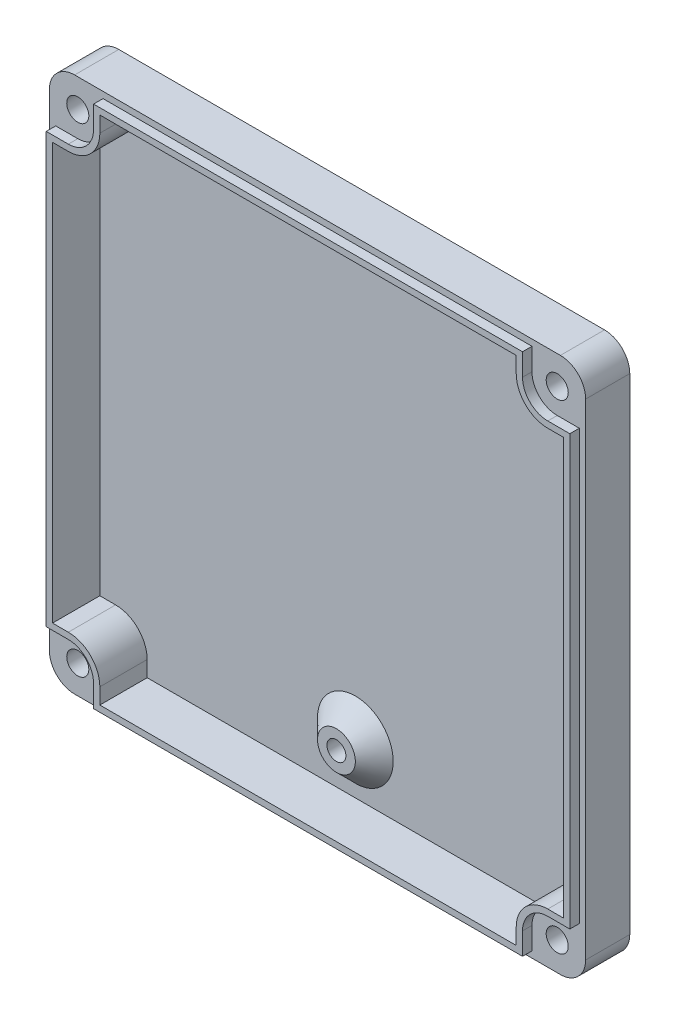
from build123d import *

# Parameters (mm, degrees)
SKETCH1_W                = 85
SKETCH1_H                = 85
BOSS_EXTRUDE1_DEPTH      = 7
FILLET1_R                = 4
SHELL1_T                 = -2
SHELL1_THICKNESS_2_DEPTH = 1
BOSS_EXTRUDE2_START      = 1
BOSS_EXTRUDE2_DEPTH      = 6
CIRPATTERN5_COUNT        = 4
SKETCH4_R                = 1.75
CUT_EXTRUDE1_DEPTH       = 61.510329697
MOVE_FACE1_BY            = 0.5
MOVE_FACE1_2_BY          = 0.5
MOVE_FACE1_3_BY          = 0.5
MOVE_FACE1_4_BY          = 0.5
MOVE_FACE1_5_BY          = 0.5
MOVE_FACE1_6_BY          = 0.5
MOVE_FACE1_7_BY          = 0.5
MOVE_FACE1_8_BY          = 0.5
MOVE_FACE1_9_BY          = 0.5
MOVE_FACE1_10_BY         = 0.5
MOVE_FACE1_11_BY         = 0.5
MOVE_FACE1_12_BY         = 0.5
EXTRUDE_THIN1_DEPTH      = 1.5
CIRPATTERN6_COUNT        = 4
SKETCH15_R               = 3.25
CUT_EXTRUDE5_DEPTH       = 2
EXTRUDE_THIN2_START      = -2
SKETCH16_R               = 2.25
SKETCH16_R_2             = 1.75
EXTRUDE_THIN2_DEPTH      = 2
SKETCH17_R               = 1.5
CUT_EXTRUDE6_DEPTH       = 61.702141643
SKETCH22_R               = 3
SKETCH22_R_2             = 1.5
BOSS_EXTRUDE5_DEPTH      = 3
CHAMFER2_SIZE            = 3


with BuildPart() as part:
    # Sketch1 → Boss-Extrude1 (new body)
    with BuildSketch(Plane.XY):
        Rectangle(SKETCH1_W, SKETCH1_H)
    extrude(amount=BOSS_EXTRUDE1_DEPTH)

    # Fillet1
    fillet1_edges = [part.edges().sort_by_distance(p)[0] for p in [
        (42.5, -42.5, 3.5),
        (-42.5, -42.5, 3.5),
        (-42.5, 42.5, 3.5),
        (42.5, 42.5, 3.5),
    ]]
    fillet(fillet1_edges, radius=FILLET1_R)

    # Shell1
    shell1_openings = [part.faces().sort_by_distance(p)[0] for p in [
        (0, 0, 7),
    ]]
    offset(amount=SHELL1_T, openings=shell1_openings, kind=Kind.INTERSECTION)

    # Shell1 thickness 2 face (on inner face of the shell) → Shell1 thickness 2 (cut)
    with BuildSketch(Plane(origin=(0, 0, 2), x_dir=(-1, 0, 0), z_dir=(0, 0, -1))):
        with BuildLine():
            ThreePointArc((40.5, -38.5), (39.914213562, -39.914213562), (38.5, -40.5))
            Line((38.5, -40.5), (-38.5, -40.5))
            ThreePointArc((-38.5, -40.5), (-39.914213562, -39.914213562), (-40.5, -38.5))
            Line((-40.5, -38.5), (-40.5, 38.5))
            ThreePointArc((-40.5, 38.5), (-39.914213562, 39.914213562), (-38.5, 40.5))
            Line((-38.5, 40.5), (38.5, 40.5))
            ThreePointArc((38.5, 40.5), (39.914213562, 39.914213562), (40.5, 38.5))
            Line((40.5, 38.5), (40.5, -38.5))
        make_face()
    extrude(amount=SHELL1_THICKNESS_2_DEPTH, mode=Mode.SUBTRACT)


with BuildPart() as body_2:
    # Sketch3 → Boss-Extrude2 (new body)
    with BuildSketch(Plane.XY.offset(BOSS_EXTRUDE2_START)):
        with BuildLine():
            Line((33.5, 38), (33.5, 42.5))
            Line((33.5, 42.5), (38, 42.5))
            ThreePointArc((38, 42.5), (41.181980515, 41.181980515), (42.5, 38))
            Line((42.5, 38), (42.5, 33.5))
            Line((42.5, 33.5), (38, 33.5))
            ThreePointArc((38, 33.5), (34.818019485, 34.818019485), (33.5, 38))
        make_face()
    extrude(amount=BOSS_EXTRUDE2_DEPTH)


with BuildPart() as cirpattern5_1:
    # CirPattern5: pattern copy
    add(body_2.part.rotate(Axis((0, 0, 0), (0, 0, 1)), 1 * 360 / CIRPATTERN5_COUNT))


with BuildPart() as cirpattern5_2:
    # CirPattern5: pattern copy
    add(body_2.part.rotate(Axis((0, 0, 0), (0, 0, 1)), 2 * 360 / CIRPATTERN5_COUNT))


with BuildPart() as cirpattern5_3:
    # CirPattern5: pattern copy
    add(body_2.part.rotate(Axis((0, 0, 0), (0, 0, 1)), 3 * 360 / CIRPATTERN5_COUNT))


with BuildPart() as part_1:
    add(part.part)

    # Combine1: union CirPattern5_1, body 2, CirPattern5_2, CirPattern5_3
    add(cirpattern5_1.part)
    add(body_2.part)
    add(cirpattern5_2.part)
    add(cirpattern5_3.part)

    # Sketch4 → Cut-Extrude1 (cut, through all)
    with BuildSketch(Plane.XY.offset(7)):
        with Locations((38, 38)):
            Circle(SKETCH4_R)
    cut_extrude1 = extrude(amount=-CUT_EXTRUDE1_DEPTH, mode=Mode.SUBTRACT)

    # Move Face1: a face moved outward by 0.5
    extrude(part_1.faces().sort_by_distance((-33.5, 39.25, 4))[0], amount=MOVE_FACE1_BY, dir=(1, 0, 0))

    # Move Face1 2: a curved face moved outward by 0.5
    add(Solid.thicken(part_1.faces().sort_by_distance((-34.818019485, 34.818019485, 4))[0], MOVE_FACE1_2_BY))

    # Move Face1 3: a face moved outward by 0.5
    extrude(part_1.faces().sort_by_distance((-39.25, 33.5, 4))[0], amount=MOVE_FACE1_3_BY, dir=(0, -1, 0))

    # Move Face1 4: a face moved outward by 0.5
    extrude(part_1.faces().sort_by_distance((-33.5, -39.25, 4))[0], amount=MOVE_FACE1_4_BY, dir=(1, 0, 0))

    # Move Face1 5: a face moved outward by 0.5
    extrude(part_1.faces().sort_by_distance((-39.25, -33.5, 4))[0], amount=MOVE_FACE1_5_BY, dir=(0, 1, 0))

    # Move Face1 6: a curved face moved outward by 0.5
    add(Solid.thicken(part_1.faces().sort_by_distance((-34.818019485, -34.818019485, 4))[0], MOVE_FACE1_6_BY))

    # Move Face1 7: a face moved outward by 0.5
    extrude(part_1.faces().sort_by_distance((33.5, -39.25, 4))[0], amount=MOVE_FACE1_7_BY, dir=(-1, 0, 0))

    # Move Face1 8: a curved face moved outward by 0.5
    add(Solid.thicken(part_1.faces().sort_by_distance((34.818019485, -34.818019485, 4))[0], MOVE_FACE1_8_BY))

    # Move Face1 9: a face moved outward by 0.5
    extrude(part_1.faces().sort_by_distance((39.25, -33.5, 4))[0], amount=MOVE_FACE1_9_BY, dir=(0, 1, 0))

    # Move Face1 10: a face moved outward by 0.5
    extrude(part_1.faces().sort_by_distance((39.25, 33.5, 4))[0], amount=MOVE_FACE1_10_BY, dir=(0, -1, 0))

    # Move Face1 11: a face moved outward by 0.5
    extrude(part_1.faces().sort_by_distance((33.5, 39.25, 4))[0], amount=MOVE_FACE1_11_BY, dir=(-1, 0, 0))

    # Move Face1 12: a curved face moved outward by 0.5
    add(Solid.thicken(part_1.faces().sort_by_distance((34.818019485, 34.818019485, 4))[0], MOVE_FACE1_12_BY))

    # Sketch7 → Extrude-Thin1 (add)
    with BuildSketch(Plane.XY.offset(7)):
        with BuildLine():
            Line((38, -34), (41.5, -34))
            Line((41.5, -34), (41.5, 34))
            Line((41.5, 34), (38, 34))
            ThreePointArc((38, 34), (35.171572875, 35.171572875), (34, 38))
            Line((34, 38), (34, 41.5))
            Line((34, 41.5), (-34, 41.5))
            Line((-34, 41.5), (-34, 38))
            ThreePointArc((-34, 38), (-35.171572875, 35.171572875), (-38, 34))
            Line((-38, 34), (-41.5, 34))
            Line((-41.5, 34), (-41.5, -34))
            Line((-41.5, -34), (-38, -34))
            ThreePointArc((-38, -34), (-35.171572875, -35.171572875), (-34, -38))
            Line((-34, -38), (-34, -41.5))
            Line((-34, -41.5), (34, -41.5))
            Line((34, -41.5), (34, -38))
            ThreePointArc((34, -38), (35.171572875, -35.171572875), (38, -34))
        make_face()
        with BuildLine():
            Line((38, -33), (40.5, -33))
            Line((40.5, -33), (40.5, 33))
            Line((40.5, 33), (38, 33))
            ThreePointArc((38, 33), (34.464466094, 34.464466094), (33, 38))
            Line((33, 38), (33, 40.5))
            Line((33, 40.5), (-33, 40.5))
            Line((-33, 40.5), (-33, 38))
            ThreePointArc((-33, 38), (-34.464466094, 34.464466094), (-38, 33))
            Line((-38, 33), (-40.5, 33))
            Line((-40.5, 33), (-40.5, -33))
            Line((-40.5, -33), (-38, -33))
            ThreePointArc((-38, -33), (-34.464466094, -34.464466094), (-33, -38))
            Line((-33, -38), (-33, -40.5))
            Line((-33, -40.5), (33, -40.5))
            Line((33, -40.5), (33, -38))
            ThreePointArc((33, -38), (34.464466094, -34.464466094), (38, -33))
        make_face(mode=Mode.SUBTRACT)
    extrude(amount=EXTRUDE_THIN1_DEPTH)

    # CirPattern6: Cut-Extrude1 ×4 about axis
    cirpattern6_axis = Axis((0, 0, 0), (0, 0, 1))
    for i in range(1, CIRPATTERN6_COUNT):
        add(cut_extrude1.rotate(cirpattern6_axis, i * 360 / CIRPATTERN6_COUNT), mode=Mode.SUBTRACT)

    # Sketch15 → Cut-Extrude5 (cut)
    with BuildSketch(Plane(origin=(0, 0, 0), x_dir=(-1, 0, 0), z_dir=(0, 0, -1))):
        with Locations((-38, -38)):
            Circle(SKETCH15_R)
        with Locations((38, -38)):
            Circle(SKETCH15_R)
        with Locations((38, 38)):
            Circle(SKETCH15_R)
        with Locations((-38, 38)):
            Circle(SKETCH15_R)
    extrude(amount=-CUT_EXTRUDE5_DEPTH, mode=Mode.SUBTRACT)

    # Sketch16 → Extrude-Thin2 (add)
    # profile 1 of 4: a face of its own
    with BuildSketch(Plane(origin=(0, 0, 0), x_dir=(-1, 0, 0), z_dir=(0, 0, -1)).offset(EXTRUDE_THIN2_START)):
        with Locations((-38, -38)):
            Circle(SKETCH16_R)
        with Locations((-38, -38)):
            Circle(SKETCH16_R_2, mode=Mode.SUBTRACT)
    # profile 2 of 4: a face of its own
    with BuildSketch(Plane(origin=(0, 0, 0), x_dir=(-1, 0, 0), z_dir=(0, 0, -1)).offset(EXTRUDE_THIN2_START)):
        with Locations((-38, 38)):
            Circle(SKETCH16_R)
        with Locations((-38, 38)):
            Circle(SKETCH16_R_2, mode=Mode.SUBTRACT)
    # profile 3 of 4: a face of its own
    with BuildSketch(Plane(origin=(0, 0, 0), x_dir=(-1, 0, 0), z_dir=(0, 0, -1)).offset(EXTRUDE_THIN2_START)):
        with Locations((38, -38)):
            Circle(SKETCH16_R)
        with Locations((38, -38)):
            Circle(SKETCH16_R_2, mode=Mode.SUBTRACT)
    # profile 4 of 4: a face of its own
    with BuildSketch(Plane(origin=(0, 0, 0), x_dir=(-1, 0, 0), z_dir=(0, 0, -1)).offset(EXTRUDE_THIN2_START)):
        with Locations((38, 38)):
            Circle(SKETCH16_R)
        with Locations((38, 38)):
            Circle(SKETCH16_R_2, mode=Mode.SUBTRACT)
    extrude(amount=EXTRUDE_THIN2_DEPTH)

    # Sketch17 → Cut-Extrude6 (cut, through all)
    with BuildSketch(Plane(origin=(0, 0, 0), x_dir=(-1, 0, 0), z_dir=(0, 0, -1))):
        with Locations((0, -32.5)):
            Circle(SKETCH17_R)
    extrude(amount=-CUT_EXTRUDE6_DEPTH, mode=Mode.SUBTRACT)

    # Sketch22 → Boss-Extrude5 (add)
    with BuildSketch(Plane.XY.offset(1)):
        with Locations(Location((0, -32.5, 0), (0, 0, 180))):
            Circle(SKETCH22_R)
        with Locations(Location((0, -32.5, 0), (0, 0, 180))):
            Circle(SKETCH22_R_2, mode=Mode.SUBTRACT)
    extrude(amount=BOSS_EXTRUDE5_DEPTH)

    # Chamfer2
    chamfer2_edges = [part_1.edges().sort_by_distance(p)[0] for p in [
        (3, -32.5, 1),
    ]]
    chamfer(chamfer2_edges, length=CHAMFER2_SIZE - 0.0001)  # a hair under: the kernel refuses the full size


solid = part_1.part
